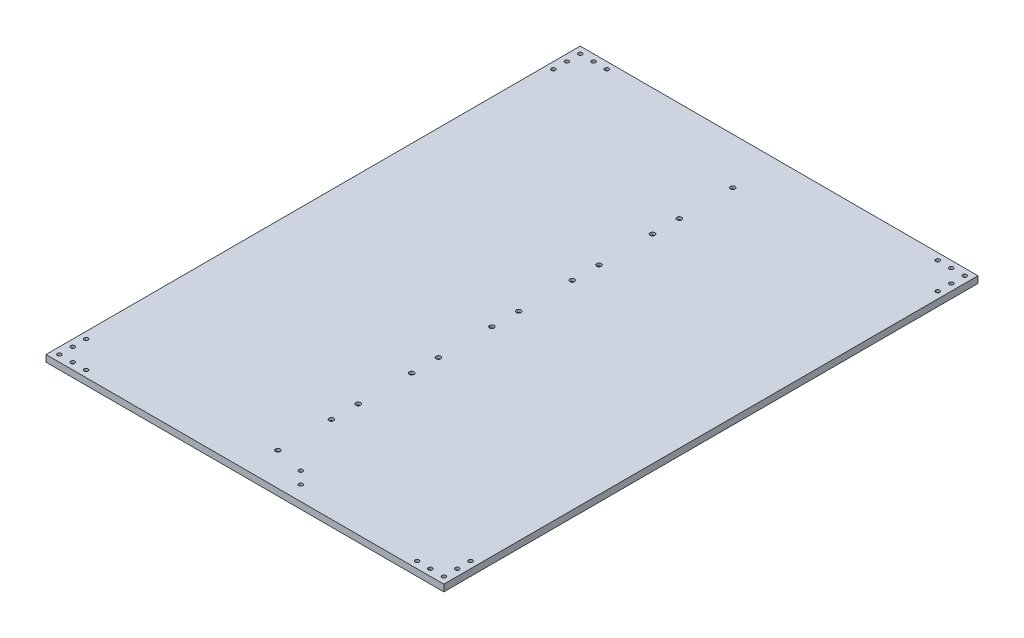
from build123d import *

# Parameters (mm, degrees)
SKETCH1_W           = 297.5
SKETCH1_H           = 399.5
BOSS_EXTRUDE1_DEPTH = 5
SKETCH3_R           = 1.749864578
SKETCH3_R_2         = 1.750391844
SKETCH3_R_3         = 1.750224182
SKETCH3_R_4         = 1.74961836
SKETCH3_R_5         = 1.75096205
SKETCH3_R_6         = 1.748620385
SKETCH3_R_7         = 1.748899818
SKETCH3_R_8         = 1.749915058
SKETCH3_R_9         = 1.748890378
SKETCH3_R_10        = 1.750988741
SKETCH3_R_11        = 1.752219163
CUT_EXTRUDE2_DEPTH  = 10
SKETCH5_R           = 1.5
CUT_EXTRUDE3_DEPTH  = 10
CUT_EXTRUDE4_START  = -3
SKETCH6_R           = 1.5
CUT_EXTRUDE4_DEPTH  = 3
CUT_EXTRUDE5_DEPTH  = 3
SKETCH13_R          = 1.5
CUT_EXTRUDE6_DEPTH  = 5
CUT_EXTRUDE7_DEPTH  = 3


with BuildPart() as part:
    # Sketch1 → Boss-Extrude1 (new body)
    with BuildSketch(Plane(origin=(0, 0, 0), x_dir=(1, 0, 0), z_dir=(0, 1, 0))):
        with Locations((148.75, 199.75)):
            Rectangle(SKETCH1_W, SKETCH1_H)
    extrude(amount=BOSS_EXTRUDE1_DEPTH)

    # Sketch3 → Cut-Extrude2 (cut)
    with BuildSketch(Plane(origin=(0, 5, 0), x_dir=(1, 0, 0), z_dir=(0, 1, 0))):
        with Locations((148.748083814, 24.684748422)):
            Circle(SKETCH3_R)
        with Locations((148.748340036, 64.683726641)):
            Circle(SKETCH3_R_2)
        with Locations((148.75044634, 84.720729049)):
            Circle(SKETCH3_R_3)
        with Locations((148.748021994, 124.721020588)):
            Circle(SKETCH3_R_4)
        with Locations((148.749007517, 144.750094856)):
            Circle(SKETCH3_R_5)
        with Locations((148.747543438, 184.752595185)):
            Circle(SKETCH3_R_6)
        with Locations((148.747015223, 204.786810925)):
            Circle(SKETCH3_R_7)
        with Locations((148.748242067, 244.786829837)):
            Circle(SKETCH3_R_8)
        with Locations((148.746998642, 264.816839038)):
            Circle(SKETCH3_R_9)
        with Locations((148.750231988, 304.815858705)):
            Circle(SKETCH3_R_10)
        with Locations((148.747015223, 324.852824112)):
            Circle(SKETCH3_R_7)
        with Locations((148.751036789, 364.852854296)):
            Circle(SKETCH3_R_11)
    extrude(amount=-CUT_EXTRUDE2_DEPTH, mode=Mode.SUBTRACT)

    # Sketch5 → Cut-Extrude3 (cut)
    with BuildSketch(Plane(origin=(0, 5, 0), x_dir=(1, 0, 0), z_dir=(0, 1, 0))):
        with Locations((5, 5)):
            Circle(SKETCH5_R)
        with Locations((5, 15)):
            Circle(SKETCH5_R)
        with Locations((15, 5)):
            Circle(SKETCH5_R)
        with Locations((5, 25)):
            Circle(SKETCH5_R)
        with Locations((25, 5)):
            Circle(SKETCH5_R)
        with Locations((25, 394.5)):
            Circle(SKETCH5_R)
        with Locations((15, 394.5)):
            Circle(SKETCH5_R)
        with Locations((5, 374.5)):
            Circle(SKETCH5_R)
        with Locations((5, 384.5)):
            Circle(SKETCH5_R)
        with Locations((5, 394.5)):
            Circle(SKETCH5_R)
        with Locations((292.5, 374.5)):
            Circle(SKETCH5_R)
        with Locations((292.5, 384.5)):
            Circle(SKETCH5_R)
        with Locations((292.5, 394.5)):
            Circle(SKETCH5_R)
        with Locations((282.5, 394.5)):
            Circle(SKETCH5_R)
        with Locations((272.5, 394.5)):
            Circle(SKETCH5_R)
        with Locations((292.5, 25)):
            Circle(SKETCH5_R)
        with Locations((292.5, 15)):
            Circle(SKETCH5_R)
        with Locations((292.5, 5)):
            Circle(SKETCH5_R)
        with Locations((282.5, 5)):
            Circle(SKETCH5_R)
        with Locations((272.5, 5)):
            Circle(SKETCH5_R)
    extrude(amount=-CUT_EXTRUDE3_DEPTH, mode=Mode.SUBTRACT)

    # Sketch6 → Cut-Extrude4 (cut)
    # profile 1 of 20: a face of its own
    with BuildSketch(Plane.XZ.offset(CUT_EXTRUDE4_START)):
        Polygon((3.104551732, -391.216987298), (1.209103465, -394.5), (3.104551732, -397.783012702), (6.895448268, -397.783012702), (8.790896535, -394.5), (6.895448267, -391.216987298), align=None)
        with Locations((5, -394.5)):
            Circle(SKETCH6_R, mode=Mode.SUBTRACT)
    # profile 2 of 20: a face of its own
    with BuildSketch(Plane.XZ.offset(CUT_EXTRUDE4_START)):
        Polygon((3.104551732, -381.216987298), (1.209103465, -384.5), (3.104551732, -387.783012702), (6.895448267, -387.783012702), (8.790896535, -384.5), (6.895448267, -381.216987298), align=None)
        with Locations((5, -384.5)):
            Circle(SKETCH6_R, mode=Mode.SUBTRACT)
    # profile 3 of 20: a face of its own
    with BuildSketch(Plane.XZ.offset(CUT_EXTRUDE4_START)):
        Polygon((3.104551732, -371.216987298), (1.209103465, -374.5), (3.104551733, -377.783012702), (6.895448268, -377.783012702), (8.790896535, -374.5), (6.895448268, -371.216987298), align=None)
        with Locations((5, -374.5)):
            Circle(SKETCH6_R, mode=Mode.SUBTRACT)
    # profile 4 of 20: a face of its own
    with BuildSketch(Plane.XZ.offset(CUT_EXTRUDE4_START)):
        Polygon((13.104551732, -391.216987298), (11.209103465, -394.5), (13.104551732, -397.783012702), (16.895448267, -397.783012702), (18.790896535, -394.5), (16.895448267, -391.216987298), align=None)
        with Locations((15, -394.5)):
            Circle(SKETCH6_R, mode=Mode.SUBTRACT)
    # profile 5 of 20: a face of its own
    with BuildSketch(Plane.XZ.offset(CUT_EXTRUDE4_START)):
        Polygon((23.104551732, -391.216987298), (21.209103465, -394.5), (23.104551732, -397.783012702), (26.895448267, -397.783012702), (28.790896535, -394.5), (26.895448268, -391.216987298), align=None)
        with Locations((25, -394.5)):
            Circle(SKETCH6_R, mode=Mode.SUBTRACT)
    # profile 6 of 20: a face of its own
    with BuildSketch(Plane.XZ.offset(CUT_EXTRUDE4_START)):
        Polygon((1.209103465, -25), (3.104551732, -28.283012702), (6.895448268, -28.283012702), (8.790896535, -25), (6.895448268, -21.716987298), (3.104551733, -21.716987298), align=None)
        with Locations((5, -25)):
            Circle(SKETCH6_R, mode=Mode.SUBTRACT)
    # profile 7 of 20: a face of its own
    with BuildSketch(Plane.XZ.offset(CUT_EXTRUDE4_START)):
        Polygon((1.209103465, -15), (3.104551732, -18.283012702), (6.895448267, -18.283012702), (8.790896535, -15), (6.895448267, -11.716987298), (3.104551732, -11.716987298), align=None)
        with Locations((5, -15)):
            Circle(SKETCH6_R, mode=Mode.SUBTRACT)
    # profile 8 of 20: a face of its own
    with BuildSketch(Plane.XZ.offset(CUT_EXTRUDE4_START)):
        Polygon((1.209103465, -5), (3.104551732, -8.283012702), (6.895448267, -8.283012702), (8.790896535, -5), (6.895448268, -1.716987298), (3.104551732, -1.716987298), align=None)
        with Locations((5, -5)):
            Circle(SKETCH6_R, mode=Mode.SUBTRACT)
    # profile 9 of 20: a face of its own
    with BuildSketch(Plane.XZ.offset(CUT_EXTRUDE4_START)):
        Polygon((11.209103465, -5), (13.104551732, -8.283012702), (16.895448267, -8.283012702), (18.790896535, -5), (16.895448267, -1.716987298), (13.104551732, -1.716987298), align=None)
        with Locations((15, -5)):
            Circle(SKETCH6_R, mode=Mode.SUBTRACT)
    # profile 10 of 20: a face of its own
    with BuildSketch(Plane.XZ.offset(CUT_EXTRUDE4_START)):
        Polygon((21.209103465, -5), (23.104551732, -8.283012702), (26.895448268, -8.283012702), (28.790896535, -5), (26.895448267, -1.716987298), (23.104551732, -1.716987298), align=None)
        with Locations((25, -5)):
            Circle(SKETCH6_R, mode=Mode.SUBTRACT)
    # profile 11 of 20: a face of its own
    with BuildSketch(Plane.XZ.offset(CUT_EXTRUDE4_START)):
        Polygon((268.709103465, -5), (270.604551732, -8.283012702), (274.395448267, -8.283012702), (276.290896535, -5), (274.395448267, -1.716987298), (270.604551732, -1.716987298), align=None)
        with Locations((272.5, -5)):
            Circle(SKETCH6_R, mode=Mode.SUBTRACT)
    # profile 12 of 20: a face of its own
    with BuildSketch(Plane.XZ.offset(CUT_EXTRUDE4_START)):
        Polygon((278.709103465, -5), (280.604551732, -8.283012702), (284.395448267, -8.283012702), (286.290896535, -5), (284.395448267, -1.716987298), (280.604551732, -1.716987298), align=None)
        with Locations((282.5, -5)):
            Circle(SKETCH6_R, mode=Mode.SUBTRACT)
    # profile 13 of 20: a face of its own
    with BuildSketch(Plane.XZ.offset(CUT_EXTRUDE4_START)):
        Polygon((288.709103465, -5), (290.604551732, -8.283012702), (294.395448267, -8.283012702), (296.290896535, -5), (294.395448267, -1.716987298), (290.604551732, -1.716987298), align=None)
        with Locations((292.5, -5)):
            Circle(SKETCH6_R, mode=Mode.SUBTRACT)
    # profile 14 of 20: a face of its own
    with BuildSketch(Plane.XZ.offset(CUT_EXTRUDE4_START)):
        Polygon((288.709103465, -15), (290.604551732, -18.283012702), (294.395448267, -18.283012702), (296.290896535, -15), (294.395448267, -11.716987298), (290.604551732, -11.716987298), align=None)
        with Locations((292.5, -15)):
            Circle(SKETCH6_R, mode=Mode.SUBTRACT)
    # profile 15 of 20: a face of its own
    with BuildSketch(Plane.XZ.offset(CUT_EXTRUDE4_START)):
        Polygon((288.709103465, -25), (290.604551732, -28.283012702), (294.395448267, -28.283012702), (296.290896535, -25), (294.395448267, -21.716987298), (290.604551732, -21.716987298), align=None)
        with Locations((292.5, -25)):
            Circle(SKETCH6_R, mode=Mode.SUBTRACT)
    # profile 16 of 20: a face of its own
    with BuildSketch(Plane.XZ.offset(CUT_EXTRUDE4_START)):
        Polygon((296.290896535, -374.5), (294.395448267, -371.216987298), (290.604551732, -371.216987298), (288.709103465, -374.5), (290.604551732, -377.783012702), (294.395448267, -377.783012702), align=None)
        with Locations((292.5, -374.5)):
            Circle(SKETCH6_R, mode=Mode.SUBTRACT)
    # profile 17 of 20: a face of its own
    with BuildSketch(Plane.XZ.offset(CUT_EXTRUDE4_START)):
        Polygon((296.290896535, -384.5), (294.395448267, -381.216987298), (290.604551732, -381.216987298), (288.709103465, -384.5), (290.604551732, -387.783012702), (294.395448267, -387.783012702), align=None)
        with Locations((292.5, -384.5)):
            Circle(SKETCH6_R, mode=Mode.SUBTRACT)
    # profile 18 of 20: a face of its own
    with BuildSketch(Plane.XZ.offset(CUT_EXTRUDE4_START)):
        Polygon((296.290896535, -394.5), (294.395448267, -391.216987298), (290.604551732, -391.216987298), (288.709103465, -394.5), (290.604551732, -397.783012702), (294.395448267, -397.783012702), align=None)
        with Locations((292.5, -394.5)):
            Circle(SKETCH6_R, mode=Mode.SUBTRACT)
    # profile 19 of 20: a face of its own
    with BuildSketch(Plane.XZ.offset(CUT_EXTRUDE4_START)):
        Polygon((286.290896535, -394.5), (284.395448267, -391.216987298), (280.604551732, -391.216987298), (278.709103465, -394.5), (280.604551732, -397.783012702), (284.395448267, -397.783012702), align=None)
        with Locations((282.5, -394.5)):
            Circle(SKETCH6_R, mode=Mode.SUBTRACT)
    # profile 20 of 20: a face of its own
    with BuildSketch(Plane.XZ.offset(CUT_EXTRUDE4_START)):
        Polygon((276.290896535, -394.5), (274.395448267, -391.216987298), (270.604551732, -391.216987298), (268.709103465, -394.5), (270.604551732, -397.783012702), (274.395448267, -397.783012702), align=None)
        with Locations((272.5, -394.5)):
            Circle(SKETCH6_R, mode=Mode.SUBTRACT)
    extrude(amount=CUT_EXTRUDE4_DEPTH, mode=Mode.SUBTRACT)

    # Sketch7 → Cut-Extrude5 (cut)
    with BuildSketch(Plane.XZ):
        Polygon((152.541933324, -364.852854296), (150.646485057, -361.569841594), (146.855588522, -361.569841594), (144.960140254, -364.852854296), (146.855588522, -368.135866999), (150.646485057, -368.135866999), align=None)
        Polygon((152.537911758, -324.852824112), (150.642463491, -321.56981141), (146.851566956, -321.56981141), (144.956118688, -324.852824112), (146.851566956, -328.135836814), (150.642463491, -328.135836814), align=None)
        Polygon((152.541128523, -304.815858705), (150.645680256, -301.532846002), (146.854783721, -301.532846002), (144.959335453, -304.815858705), (146.854783721, -308.098871407), (150.645680256, -308.098871407), align=None)
        Polygon((152.537895177, -264.816839038), (150.64244691, -261.533826336), (146.851550375, -261.533826336), (144.956102107, -264.816839038), (146.851550375, -268.099851741), (150.64244691, -268.099851741), align=None)
        Polygon((152.539138602, -244.786829837), (150.643690334, -241.503817134), (146.852793799, -241.503817134), (144.957345532, -244.786829837), (146.852793799, -248.069842539), (150.643690334, -248.069842539), align=None)
        Polygon((152.538980349, -24.684748422), (150.643532082, -21.40173572), (146.852635547, -21.40173572), (144.957187279, -24.684748422), (146.852635547, -27.967761125), (150.643532082, -27.967761125), align=None)
        Polygon((152.539236571, -64.683726641), (150.643788303, -61.400713939), (146.852891768, -61.400713939), (144.957443501, -64.683726641), (146.852891768, -67.966739344), (150.643788303, -67.966739344), align=None)
        Polygon((152.541342875, -84.720729049), (150.645894608, -81.437716346), (146.854998073, -81.437716346), (144.959549805, -84.720729049), (146.854998073, -88.003741751), (150.645894608, -88.003741751), align=None)
        Polygon((152.538918529, -124.721020588), (150.643470261, -121.438007886), (146.852573726, -121.438007886), (144.957125459, -124.721020588), (146.852573726, -128.004033291), (150.643470261, -128.004033291), align=None)
        Polygon((152.539904052, -144.750094856), (150.644455784, -141.467082153), (146.853559249, -141.467082153), (144.958110982, -144.750094856), (146.853559249, -148.033107558), (150.644455784, -148.033107558), align=None)
        Polygon((152.538439973, -184.752595185), (150.642991706, -181.469582482), (146.852095171, -181.469582482), (144.956646903, -184.752595185), (146.852095171, -188.035607887), (150.642991706, -188.035607887), align=None)
        Polygon((152.537911758, -204.786810925), (150.642463491, -201.503798222), (146.851566956, -201.503798222), (144.956118688, -204.786810925), (146.851566956, -208.069823627), (150.642463491, -208.069823627), align=None)
    extrude(amount=-CUT_EXTRUDE5_DEPTH, mode=Mode.SUBTRACT)

    # Sketch13 → Cut-Extrude6 (cut)
    with BuildSketch(Plane(origin=(0, 5, 0), x_dir=(1, 0, 0), z_dir=(0, 1, 0))):
        with Locations((170.5, 20)):
            Circle(SKETCH13_R)
        with Locations((179.5, 11)):
            Circle(SKETCH13_R)
    extrude(amount=-CUT_EXTRUDE6_DEPTH, mode=Mode.SUBTRACT)

    # Sketch14 → Cut-Extrude7 (cut)
    with BuildSketch(Plane.XZ):
        Polygon((181.524855436, -14.20481778), (183.28788133, -10.848832643), (181.263025894, -7.644014863), (177.475144564, -7.79518222), (175.71211867, -11.151167357), (177.736974106, -14.355985137), align=None)
        Polygon((172.524855436, -23.20481778), (174.28788133, -19.848832643), (172.263025894, -16.644014863), (168.475144564, -16.79518222), (166.71211867, -20.151167357), (168.736974106, -23.355985137), align=None)
    extrude(amount=-CUT_EXTRUDE7_DEPTH, mode=Mode.SUBTRACT)


solid = part.part
